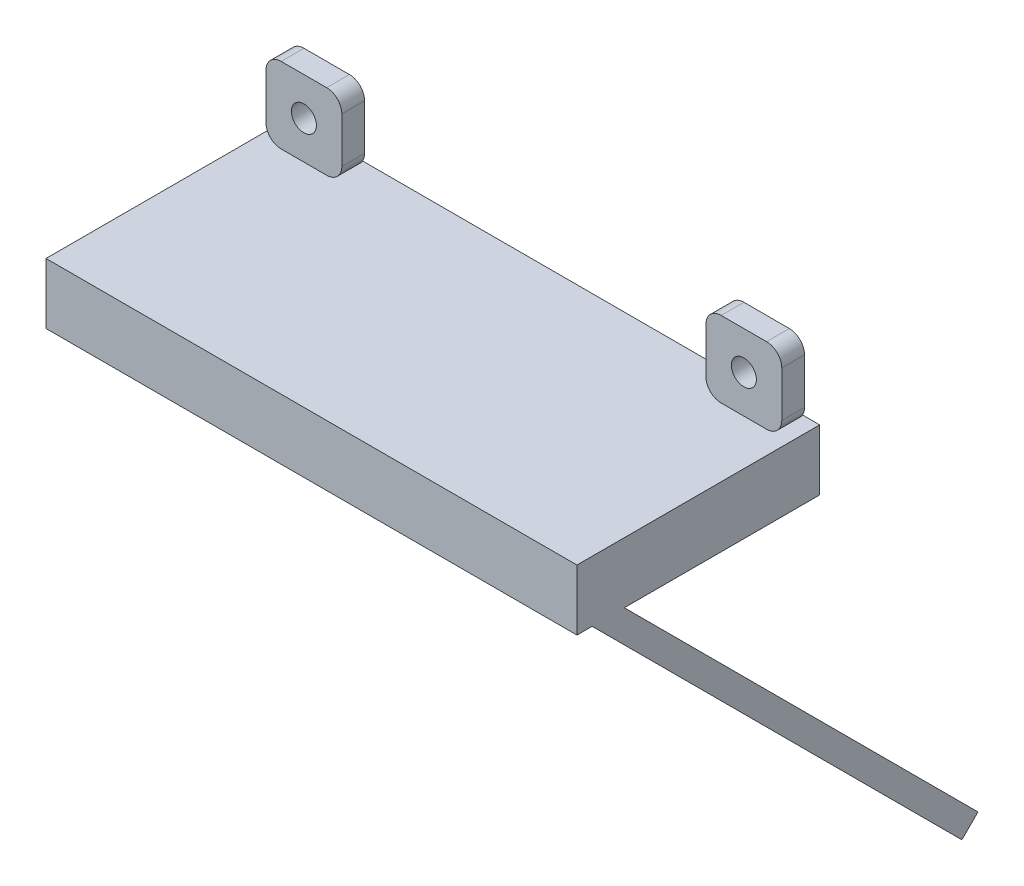
from build123d import *

# Parameters (mm, degrees)
F_70MM_45_3MM_START   = -35
F_70MM_45_3MM_DEPTH   = 70
EXTRUDE_START         = 2
SKETCH_8_W            = 70
SKETCH_8_H            = 8
EXTRUDE_307_DEPTH     = 32
EXTRUDE_START_2       = 3
SKETCH_9_R            = 1.65
EXTRUDE_M3_1_DEPTH    = 3
SKETCH_10_R           = 1.65
EXTRUDE_M3_1_2_DEPTH  = 3
F_36X48_M3_DEPTH      = 3.1
F_36X48_M3_DEPTH_BACK = 3.1
SKETCH_11_R           = 1.65
CUT_EXTRUDE_START     = -8
SKETCH_12_R           = 3.2
CUT_EXTRUDE_818_DEPTH = 3.8


with BuildPart() as part:
    # 草图1 → 70mm紧凑45度雷达承托面_3mm (new body)
    with BuildSketch(Plane(origin=(0, 0, 0), x_dir=(0, 0, -1), z_dir=(1, 0, 0)).offset(F_70MM_45_3MM_START)):
        Polygon((16.748737342, -84.748737342), (-32.748737342, -35.251262658), (-30.627416998, -33.129942315), (18.870057685, -82.627416998), align=None)
    extrude(amount=F_70MM_45_3MM_DEPTH)

    # 草图8 → Extrude 307 (add)
    with BuildSketch(Plane.XY.offset(EXTRUDE_START)):
        with Locations((0, -32)):
            Rectangle(SKETCH_8_W, SKETCH_8_H)
    extrude(amount=EXTRUDE_307_DEPTH)

    # 草图9 → Extrude M3__-1 (add)
    with BuildSketch(Plane.XY.offset(EXTRUDE_START_2)):
        with BuildLine():
            Line((-32, -28), (-26, -28))
            ThreePointArc((-26, -28), (-24.585786438, -27.414213562), (-24, -26))
            Line((-24, -26), (-24, -20))
            ThreePointArc((-24, -20), (-24.585786438, -18.585786438), (-26, -18))
            Line((-26, -18), (-32, -18))
            ThreePointArc((-32, -18), (-33.414213562, -18.585786438), (-34, -20))
            Line((-34, -20), (-34, -26))
            ThreePointArc((-34, -26), (-33.414213562, -27.414213562), (-32, -28))
        make_face()
        with Locations((-29, -23)):
            Circle(SKETCH_9_R, mode=Mode.SUBTRACT)
    extrude(amount=EXTRUDE_M3_1_DEPTH)

    # 草图10 → Extrude M3__1 2 (add)
    with BuildSketch(Plane.XY.offset(EXTRUDE_START_2)):
        with BuildLine():
            Line((26, -28), (32, -28))
            ThreePointArc((32, -28), (33.414213562, -27.414213562), (34, -26))
            Line((34, -26), (34, -20))
            ThreePointArc((34, -20), (33.414213562, -18.585786438), (32, -18))
            Line((32, -18), (26, -18))
            ThreePointArc((26, -18), (24.585786438, -18.585786438), (24, -20))
            Line((24, -20), (24, -26))
            ThreePointArc((24, -26), (24.585786438, -27.414213562), (26, -28))
        make_face()
        with Locations((29, -23)):
            Circle(SKETCH_10_R, mode=Mode.SUBTRACT)
    extrude(amount=EXTRUDE_M3_1_2_DEPTH)

    # 草图11 → 端口朝下雷达36x48四M3孔 (cut, two sides: drawn at the far end of the back side and taken through both)
    with BuildSketch(Plane(origin=(0, -34, 34), x_dir=(1, 0, 0), z_dir=(0, -0.7071067811865477, 0.7071067811865475)).offset(-F_36X48_M3_DEPTH_BACK)):
        with Locations(Location((-18, -60.769552622, 0), (0, 0, 270))):
            Circle(SKETCH_11_R)
        with Locations(Location((-18, -12.769552622, 0), (0, 0, 270))):
            Circle(SKETCH_11_R)
        with Locations(Location((18, -60.769552622, 0), (0, 0, 270))):
            Circle(SKETCH_11_R)
        with Locations(Location((18, -12.769552622, 0), (0, 0, 270))):
            Circle(SKETCH_11_R)
    extrude(amount=F_36X48_M3_DEPTH + F_36X48_M3_DEPTH_BACK, mode=Mode.SUBTRACT)

    # 草图12 → Cut-Extrude 818 (cut)
    with BuildSketch(Plane(origin=(0, -34, 34), x_dir=(1, 0, 0), z_dir=(0, -0.7071067811865477, 0.7071067811865475)).offset(CUT_EXTRUDE_START)):
        with Locations((-18, -12.769552622)):
            Circle(SKETCH_12_R)
        with Locations((18, -12.769552622)):
            Circle(SKETCH_12_R)
    extrude(amount=CUT_EXTRUDE_818_DEPTH, mode=Mode.SUBTRACT)


solid = part.part
